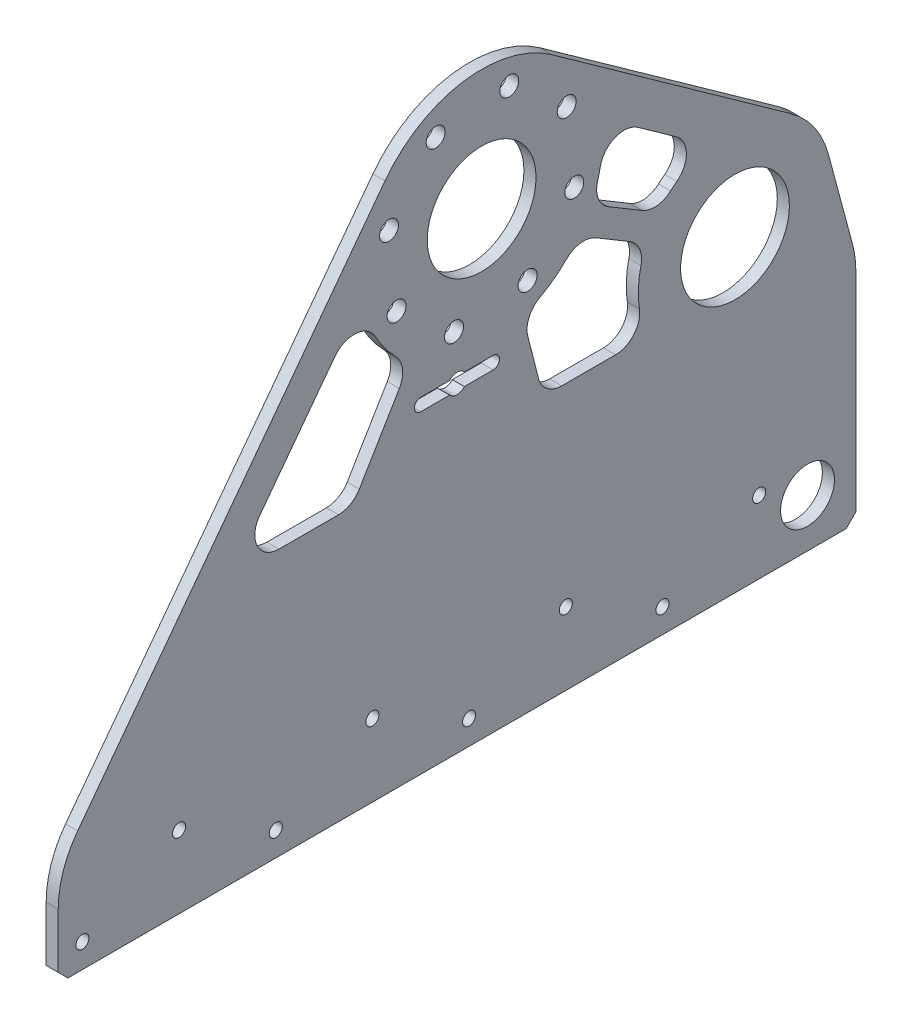
from build123d import *

# Parameters (mm, degrees)
SKETCH1_R                    = 14.2875
BOSS_EXTRUDE1_DEPTH          = 3.175
F_10_CLEARANCE_HOLE1_D       = 4.9784
SKETCH9_R                    = 7.0739
CUT_EXTRUDE1_DEPTH           = 246.051592782
FILLET1_R                    = 6.35
F_1_8_0_135_DIAMETER_HOLE1_D = 3.429
CHAMFER1_SIZE                = 2.54
CUT_EXTRUDE2_DEPTH           = 246.051592782


with BuildPart() as part:
    # Sketch1 → Boss-Extrude1 (new body)
    with BuildSketch(Plane(origin=(0, 0, 0), x_dir=(0, 0, -1), z_dir=(1, 0, 0))):
        with BuildLine():
            Line((0, -25.4), (0, 31.863977372))
            ThreePointArc((0, 31.863977372), (-0.217300521, 35.179342654), (-0.865484012, 38.437981118))
            Line((-0.865484012, 38.437981118), (-7.215484012, 62.136503746))
            ThreePointArc((-7.215484012, 62.136503746), (-10.879443925, 70.039374287), (-16.998077198, 76.239559115))
            Line((-16.998077198, 76.239559115), (-79.87164219, 121.096323894))
            ThreePointArc((-79.87164219, 121.096323894), (-103.165558841, 126.626759813), (-123.699445398, 114.31612306))
            Line((-123.699445398, 114.31612306), (-204.460319765, 6.777271443))
            ThreePointArc((-204.460319765, 6.777271443), (-208.244004669, -0.435792492), (-209.55, -8.475627004))
            Line((-209.55, -8.475627004), (-209.55, -25.4))
            Line((-209.55, -25.4), (0, -25.4))
        make_face()
        with Locations((-31.75, 55.5625)):
            Circle(SKETCH1_R, mode=Mode.SUBTRACT)
        with Locations((-98.311545692, 95.25)):
            Circle(SKETCH1_R, mode=Mode.SUBTRACT)
    extrude(amount=BOSS_EXTRUDE1_DEPTH)

    # #10 Clearance Hole1 (through all)
    with Locations(Plane(origin=(3.175, 0, 0), x_dir=(0, 0, -1), z_dir=(1, 0, 0))):
        with Locations((-91.050282965, 119.589968439), (-75.966100841, 107.326468623), (-73.971577253, 87.988737273), (-86.235077069, 72.904555149), (-105.572808419, 70.910031561), (-120.656990543, 83.173531377), (-122.651514131, 102.511262727), (-110.388014315, 117.595444851)):
            Hole(F_10_CLEARANCE_HOLE1_D / 2)

    # Sketch9 → Cut-Extrude1 (cut, through all)
    with BuildSketch(Plane(origin=(3.175, 0, 0), x_dir=(0, 0, -1), z_dir=(1, 0, 0))):
        with Locations((-12.7, -12.7)):
            Circle(SKETCH9_R)
        with BuildLine():
            Line((-164.256457276, 44.45), (-129.69901081, 90.465699272))
            ThreePointArc((-129.69901081, 90.465699272), (-125.509192978, 78.868593403), (-117.217117013, 69.742317372))
            Line((-117.217117013, 69.742317372), (-132.297729028, 44.45))
            Line((-132.297729028, 44.45), (-164.256457276, 44.45))
        make_face()
        with BuildLine():
            Line((-66.945646017, 100.173701616), (-38.671072347, 80.001377993))
            ThreePointArc((-38.671072347, 80.001377993), (-45.921454308, 76.641633825), (-51.769190034, 71.195542903))
            Line((-51.769190034, 71.195542903), (-69.551855526, 81.798504859))
            ThreePointArc((-69.551855526, 81.798504859), (-66.876157951, 90.791424263), (-66.945646017, 100.173701616))
        make_face()
        with BuildLine():
            Line((-55.021197572, 65.741466723), (-72.803863064, 76.344428679))
            ThreePointArc((-72.803863064, 76.344428679), (-79.339445973, 69.791761015), (-87.487017182, 65.402184627))
            Line((-87.487017182, 65.402184627), (-82.187487541, 44.45))
            Line((-82.187487541, 44.45), (-54.59014763, 44.45))
            ThreePointArc((-54.59014763, 44.45), (-57.144796276, 55.048377342), (-55.021197572, 65.741466723))
        make_face()
    extrude(amount=-CUT_EXTRUDE1_DEPTH, mode=Mode.SUBTRACT)

    # Fillet1
    fillet1_edges = [part.edges().sort_by_distance(p)[0] for p in [
        (1.5875, 100.173701616, 66.945646017),
        (1.5875, 71.195542903, 51.769190034),
        (1.5875, 81.798504859, 69.551855526),
        (1.5875, 80.001377993, 38.671072347),
        (1.5875, 76.344428679, 72.803863064),
        (1.5875, 65.741466723, 55.021197572),
        (1.5875, 44.45, 82.187487541),
        (1.5875, 65.402184627, 87.487017182),
        (1.5875, 44.45, 54.59014763),
        (1.5875, 44.45, 164.256457276),
        (1.5875, 90.465699272, 129.69901081),
        (1.5875, 69.742317372, 117.217117013),
        (1.5875, 44.45, 132.297729028),
    ]]
    fillet(fillet1_edges, radius=FILLET1_R)

    # 1/8 (0.135) Diameter Hole1 (through all)
    with Locations(Plane(origin=(3.175, 0, 0), x_dir=(0, 0, -1), z_dir=(1, 0, 0))):
        with Locations((-177.8, -6.35), (-152.4, -19.05), (-127, -6.35), (-101.6, -19.05), (-76.2, -6.35), (-50.8, -19.05), (-25.4, -6.35), (-203.2, -19.05)):
            Hole(F_1_8_0_135_DIAMETER_HOLE1_D / 2)

    # Chamfer1
    chamfer1_edges = [part.edges().sort_by_distance(p)[0] for p in [
        (1.5875, -25.4, 0),
        (1.5875, -25.4, 209.55),
    ]]
    chamfer(chamfer1_edges, length=CHAMFER1_SIZE)

    # Sketch12 → Cut-Extrude2 (cut, through all)
    with BuildSketch(Plane(origin=(3.175, 0, 0), x_dir=(0, 0, -1), z_dir=(1, 0, 0))):
        with BuildLine():
            Line((-102.843114241, 60.3885), (-95.265028797, 60.3885))
            ThreePointArc((-95.265028797, 60.3885), (-93.614028797, 58.7375), (-95.265028797, 57.0865))
            Line((-95.265028797, 57.0865), (-102.843114241, 57.0865))
            ThreePointArc((-102.843114241, 57.0865), (-104.790028797, 56.1848), (-106.736943354, 57.0865))
            Line((-106.736943354, 57.0865), (-114.315028797, 57.0865))
            ThreePointArc((-114.315028797, 57.0865), (-115.966028797, 58.7375), (-114.315028797, 60.3885))
            Line((-114.315028797, 60.3885), (-106.736943354, 60.3885))
            ThreePointArc((-106.736943354, 60.3885), (-104.790028797, 61.2902), (-102.843114241, 60.3885))
        make_face()
    extrude(amount=-CUT_EXTRUDE2_DEPTH, mode=Mode.SUBTRACT)


solid = part.part
